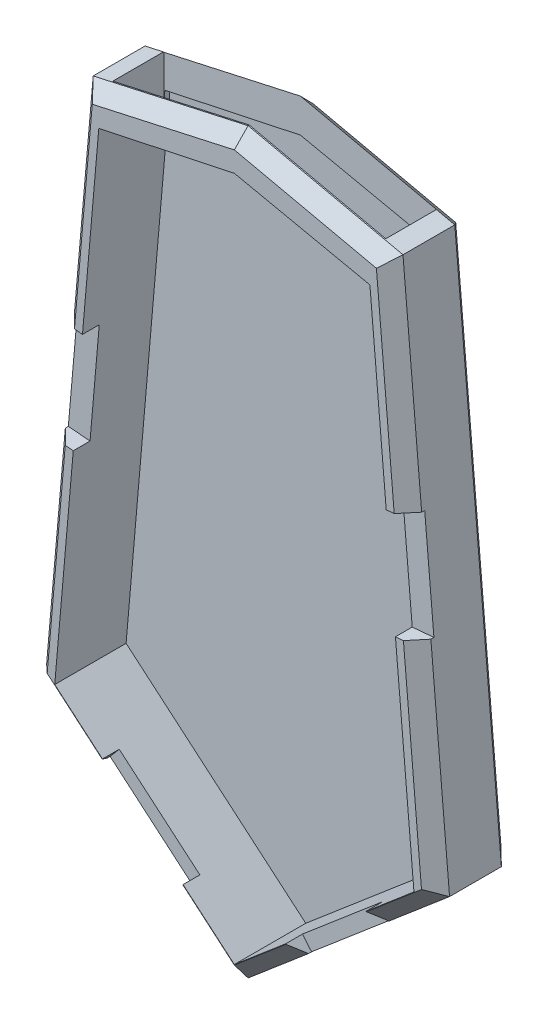
from build123d import *

# Parameters (mm, degrees)
BOSS_EXTRUDE1_DEPTH = 15
BOSS_EXTRUDE2_DEPTH = 1.5
SKETCH4_W           = 51.62387155
SKETCH4_H           = 9.672418812
CUT_EXTRUDE2_DEPTH  = 144.5
SKETCH9_W           = 20
SKETCH9_H           = 3.175
CUT_EXTRUDE3_DEPTH  = 5.5
SKETCH6_W           = 3.175
SKETCH6_H           = 20
CUT_EXTRUDE4_DEPTH  = 5.5
SKETCH8_W           = 20
SKETCH8_H           = 3.175
CUT_EXTRUDE5_DEPTH  = 5.5
SKETCH7_W           = 3.175
SKETCH7_H           = 20
CUT_EXTRUDE6_DEPTH  = 5.5
CHAMFER1_SIZE       = 2.6


with BuildPart() as part:
    # Sketch1 → Boss-Extrude1 (new body)
    with BuildSketch(Plane.XY):
        Polygon((-59.040836406, -0.235043033), (-20.940836406, -32.613894155), (17.159163594, -0.235043033), (8.348043807, 100.476516972), (-20.940836406, 106.96970539), (-50.22971662, 100.476516972), align=None)
        Polygon((-46.574564783, 95.01395338), (-20.940836406, 100.476516972), (4.69289197, 95.01395338), (13.026099369, -0.235043033), (-20.940836406, -29.10145659), (-54.907772181, -0.235043033), align=None, mode=Mode.SUBTRACT)
    extrude(amount=BOSS_EXTRUDE1_DEPTH)

    # Sketch1<6> → Boss-Extrude2 (add)
    with BuildSketch(Plane.XY):
        Polygon((-54.907772181, -0.235043033), (-46.574564783, 95.01395338), (-20.940836406, 100.476516972), (4.69289197, 95.01395338), (13.026099369, -0.235043033), (-20.940836406, -29.10145659), align=None)
    extrude(amount=BOSS_EXTRUDE2_DEPTH)

    # Sketch4 → Cut-Extrude2 (cut)
    with BuildSketch(Plane(origin=(0, 0, 0), x_dir=(1, 0, 0), z_dir=(0, 1, 0))):
        with Locations((-20.940836406, -7.336209406)):
            Rectangle(SKETCH4_W, SKETCH4_H)
    extrude(amount=CUT_EXTRUDE2_DEPTH, mode=Mode.SUBTRACT)

    # Sketch9 → Cut-Extrude3 (cut)
    with BuildSketch(Plane(origin=(7.31178106, -8.603728938, 0), x_dir=(0.7619999999999999, 0.6475770224459791, 0), z_dir=(0.6475770224459791, -0.7619999999999999, 0))):
        with Locations((-12.076925809, 13.4125)):
            Rectangle(SKETCH9_W, SKETCH9_H)
    extrude(amount=-CUT_EXTRUDE3_DEPTH, mode=Mode.SUBTRACT)

    # Sketch6 → Cut-Extrude4 (cut)
    with BuildSketch(Plane(origin=(17.008413071, 1.488043328, 0), x_dir=(0, 0, -1), z_dir=(0.9961946980917459, 0.08715574274765506, 0))):
        with Locations((-13.4125, 48.820331729)):
            Rectangle(SKETCH6_W, SKETCH6_H)
    extrude(amount=-CUT_EXTRUDE4_DEPTH, mode=Mode.SUBTRACT)

    # Sketch8 → Cut-Extrude5 (cut)
    with BuildSketch(Plane(origin=(-24.875111844, -29.270394977, 0), x_dir=(0.7620000000000001, -0.6475770224459789, 0), z_dir=(-0.6475770224459789, -0.7620000000000001, 0))):
        with Locations((-19.836908874, 13.4125)):
            Rectangle(SKETCH8_W, SKETCH8_H)
    extrude(amount=-CUT_EXTRUDE5_DEPTH, mode=Mode.SUBTRACT)

    # Sketch7 → Cut-Extrude6 (cut)
    with BuildSketch(Plane(origin=(-58.571947524, 5.124381409, 0), x_dir=(0, 0, 1), z_dir=(-0.996194698091746, 0.0871557427476544, 0))):
        with Locations((13.4125, 45.170103428)):
            Rectangle(SKETCH7_W, SKETCH7_H)
    extrude(amount=-CUT_EXTRUDE6_DEPTH, mode=Mode.SUBTRACT)

    # Chamfer1
    # the kernel refuses this chamfer: 2.6 mm, written as the material it takes off along each edge
    with BuildSketch(Plane(origin=(-14.412954441, 108.41690198, 0), x_dir=(0.2163577817803448, -0.9759268861100734, -0.027495876610586355), z_dir=(-0.976296007119934, -0.21643961393810024, 0)), Plane(origin=(-14.412954441, 108.41690198, 15), x_dir=(-0.0059511969184851, 0.026844114547178517, -0.9996219169112966), z_dir=(-0.976296007119934, -0.21643961393810024, 0)), Plane(origin=(14.875925773, 99.029320382, 15), x_dir=(0.0059511969184853734, 0.026844114547178898, -0.9996219169112966), z_dir=(-0.9762960071199325, 0.2164396139381068, 0)), Plane(origin=(14.875925773, 99.029320382, 0), x_dir=(-0.21635778178035134, -0.9759268861100718, -0.027495876610586386), z_dir=(-0.9762960071199325, 0.2164396139381068, 0))) as chamfer1_piece_1:
        Polygon((CHAMFER1_SIZE * 0.999621916911, CHAMFER1_SIZE * 0.0274958766106), (-CHAMFER1_SIZE * 0.0274958766106, CHAMFER1_SIZE * 0.999621916911), (0, 0), align=None)
    extrude(amount=43.372751537, mode=Mode.SUBTRACT)
    with BuildSketch(Plane(origin=(-49.646960573, 107.137449062, 0), x_dir=(0.9958180537233415, -0.0871227906352381, -0.02749587661058639), z_dir=(-0.08715574274765436, -0.9961946980917459, 0)), Plane(origin=(17.74191964, -6.895975123, 0), x_dir=(-0.9958180537233413, -0.08712279063523876, -0.027495876610586372), z_dir=(-0.08715574274765503, 0.9961946980917459, 0))) as chamfer1_piece_2:
        Polygon((CHAMFER1_SIZE * 0.999621916911, CHAMFER1_SIZE * 0.0274958766106), (-CHAMFER1_SIZE * 0.0274958766106, CHAMFER1_SIZE * 0.999621916911), (0, 0), align=None)
    extrude(amount=114.46901334, mode=Mode.SUBTRACT)
    with BuildSketch(Plane(origin=(-64.135854742, 4.094900279, 0), x_dir=(-0.017805697905026136, -0.02095185797726749, 0.9996219169112966), z_dir=(0.762, -0.6475770224459791, 0))) as chamfer1_piece_3:
        Polygon((CHAMFER1_SIZE * 0.999621916911, -CHAMFER1_SIZE * 0.0274958766106), (-CHAMFER1_SIZE * 0.0274958766106, -CHAMFER1_SIZE * 0.999621916911), (0, 0), align=None)
    extrude(amount=63.372751537, mode=Mode.SUBTRACT)
    with BuildSketch(Plane(origin=(-26.035854742, -36.943837466, 0), x_dir=(-0.6473321845251594, 0.761711900686408, -0.027495876610586337), z_dir=(0.762, 0.6475770224459791, 0))) as chamfer1_piece_4:
        Polygon((CHAMFER1_SIZE * 0.999621916911, CHAMFER1_SIZE * 0.0274958766106), (-CHAMFER1_SIZE * 0.0274958766106, CHAMFER1_SIZE * 0.999621916911), (0, 0), align=None)
    extrude(amount=63.372751537, mode=Mode.SUBTRACT)
    with BuildSketch(Plane(origin=(-26.035854742, -36.943837466, 15), x_dir=(0.017805697905026178, -0.02095185797726754, -0.9996219169112966), z_dir=(0.762, 0.6475770224459791, 0)), Plane(origin=(-37.465854742, -18.570295507, 15), x_dir=(-0.017805697905026636, -0.020951857977268076, -0.9996219169112966), z_dir=(0.762, -0.6475770224459791, 0)), Plane(origin=(-64.135854742, 4.094900279, 15), x_dir=(-0.017805697905026147, -0.0209518579772675, -0.9996219169112966), z_dir=(0.762, -0.6475770224459791, 0)), Plane(origin=(0.634145258, -14.278641681, 15), x_dir=(0.017805697905025515, -0.020951857977266758, -0.9996219169112966), z_dir=(0.762, 0.6475770224459791, 0))) as chamfer1_piece_5:
        Polygon((CHAMFER1_SIZE * 0.999621916911, CHAMFER1_SIZE * 0.0274958766106), (-CHAMFER1_SIZE * 0.0274958766106, CHAMFER1_SIZE * 0.999621916911), (0, 0), align=None)
    extrude(amount=28.372751537, mode=Mode.SUBTRACT)
    with BuildSketch(Plane(origin=(-54.923914991, 46.821584065, 15), x_dir=(0.9958180537233415, -0.0871227906352381, 0.027495876610586705), z_dir=(-0.08715574274765436, -0.9961946980917459, 0))) as chamfer1_piece_6:
        Polygon((CHAMFER1_SIZE * 0.999621916911, -CHAMFER1_SIZE * 0.0274958766106), (-CHAMFER1_SIZE * 0.0274958766106, -CHAMFER1_SIZE * 0.999621916911), (0, 0), align=None)
    extrude(amount=53.922751537, mode=Mode.SUBTRACT)
    with BuildSketch(Plane(origin=(-49.646960573, 107.137449062, 15), x_dir=(-0.02739124649885124, 0.002396423548493534, -0.9996219169112966), z_dir=(-0.08715574274765436, -0.9961946980917459, 0)), Plane(origin=(12.464639417, 53.423613846, 15), x_dir=(0.027391246498851204, 0.0023964235484935496, -0.9996219169112966), z_dir=(-0.08715574274765503, 0.9961946980917459, 0))) as chamfer1_piece_7:
        Polygon((CHAMFER1_SIZE * 0.999621916911, CHAMFER1_SIZE * 0.0274958766106), (-CHAMFER1_SIZE * 0.0274958766106, CHAMFER1_SIZE * 0.999621916911), (0, 0), align=None)
    extrude(amount=53.91901334, mode=Mode.SUBTRACT)
    with BuildSketch(Plane(origin=(17.74191964, -6.895975123, 15), x_dir=(0.027391246498850576, 0.0023964235484934945, -0.9996219169112966), z_dir=(-0.08715574274765503, 0.9961946980917459, 0))) as chamfer1_piece_8:
        Polygon((CHAMFER1_SIZE * 0.999621916911, CHAMFER1_SIZE * 0.0274958766106), (-CHAMFER1_SIZE * 0.0274958766106, CHAMFER1_SIZE * 0.999621916911), (0, 0), align=None)
    extrude(amount=53.922751537, mode=Mode.SUBTRACT)


solid = part.part
